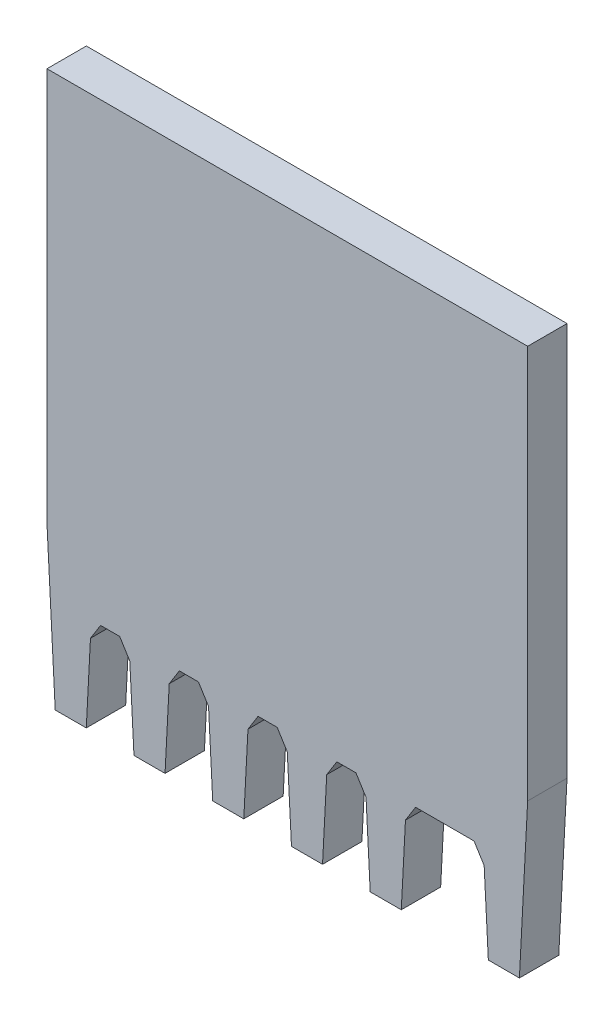
from build123d import *

# Parameters (mm, degrees)
BOSS_EXTRUDE1_DEPTH = 1.5


with BuildPart() as part:
    # Sketch1 → Boss-Extrude1 (new body)
    with BuildSketch(Plane.XY):
        Polygon((0, 6), (0.314446676, 0), (1.497941481, 0), (1.657221927, 3.039251967), (2.042586863, 3.65596478), (2.769801294, 3.65596478), (3.155166229, 3.039251967), (3.314446676, 0), (4.497941481, 0), (4.657221927, 3.039251967), (5.042586863, 3.65596478), (5.769801294, 3.65596478), (6.155166229, 3.039251967), (6.314446676, 0), (7.497941481, 0), (7.657221927, 3.039251967), (8.042586863, 3.65596478), (8.769801294, 3.65596478), (9.155166229, 3.039251967), (9.314446676, 0), (10.497941481, 0), (10.657221927, 3.039251967), (11.042586863, 3.65596478), (11.769801294, 3.65596478), (12.155166229, 3.039251967), (12.314446676, 0), (13.497941481, 0), (13.657221927, 3.039251967), (14.042586863, 3.65596478), (16.269801294, 3.65596478), (16.655166229, 3.039251967), (16.814446676, 0), (17.997941481, 0), (18.312388157, 6), (18.312388157, 21), (0, 21), align=None)
    extrude(amount=BOSS_EXTRUDE1_DEPTH)


solid = part.part
